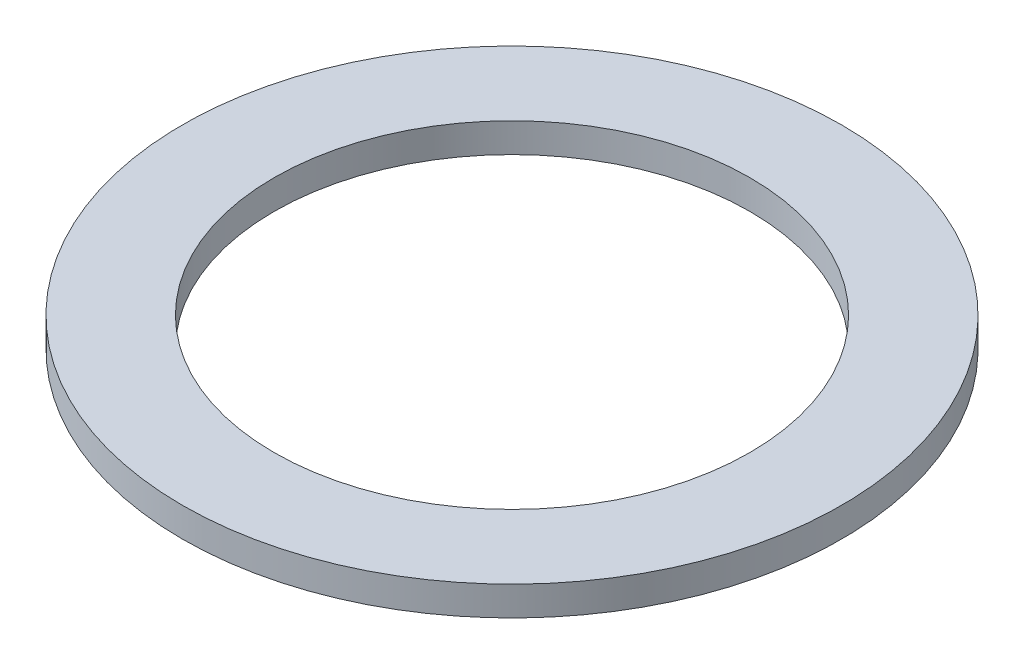
from build123d import *

# Parameters (mm, degrees)
SKETCH1_R           = 45
BOSS_EXTRUDE1_DEPTH = 4
SKETCH2_R           = 32.5
CUT_EXTRUDE1_DEPTH  = 64.765194268


with BuildPart() as part:
    # Sketch1 → Boss-Extrude1 (new body)
    with BuildSketch(Plane(origin=(0, 0, 0), x_dir=(1, 0, 0), z_dir=(0, 1, 0))):
        Circle(SKETCH1_R)
    extrude(amount=BOSS_EXTRUDE1_DEPTH)

    # Sketch2 → Cut-Extrude1 (cut, through all)
    with BuildSketch(Plane(origin=(0, 0, 0), x_dir=(1, 0, 0), z_dir=(0, 1, 0))):
        Circle(SKETCH2_R)
    extrude(amount=CUT_EXTRUDE1_DEPTH, mode=Mode.SUBTRACT)


solid = part.part
